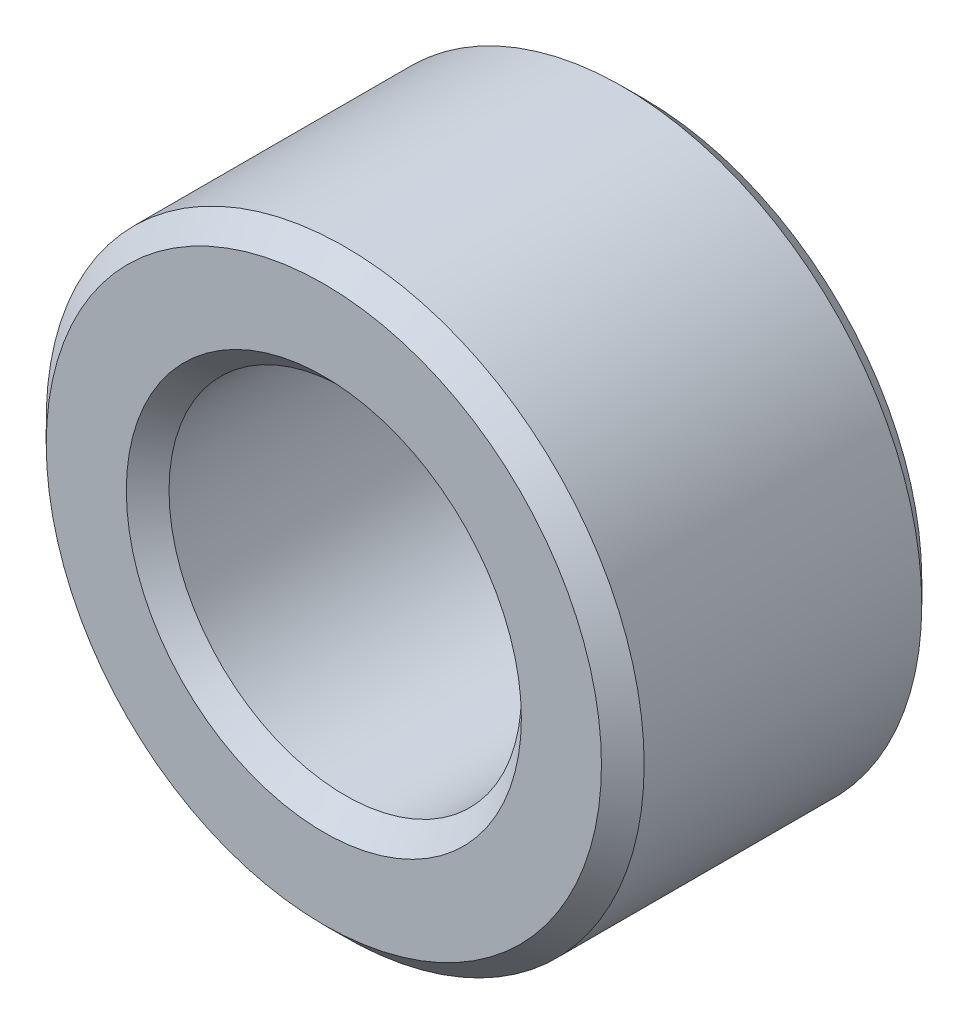
from build123d import *

# Parameters (mm, degrees)
SKETCH1_R           = 2.8
SKETCH1_R_2         = 1.65
BOSS_EXTRUDE1_DEPTH = 3
DEBURS_SIZE         = 0.2


with BuildPart() as part:
    # Sketch1 → Boss-Extrude1 (new body)
    with BuildSketch(Plane.XY):
        Circle(SKETCH1_R)
        Circle(SKETCH1_R_2, mode=Mode.SUBTRACT)
    extrude(amount=BOSS_EXTRUDE1_DEPTH)

    # Deburs
    deburs_edges = [part.edges().sort_by_distance(p)[0] for p in [
        (-1.65, 0, 0),
        (-1.65, 0, 3),
        (-2.8, 0, 0),
        (-2.8, 0, 3),
    ]]
    chamfer(deburs_edges, length=DEBURS_SIZE)


solid = part.part
